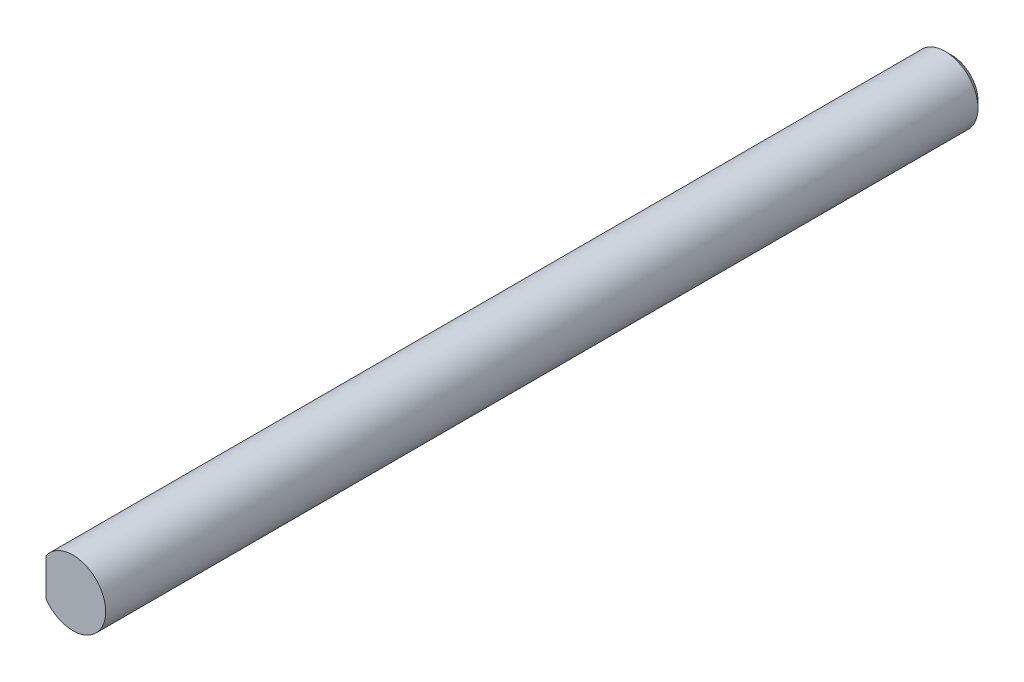
from build123d import *

# Parameters (mm, degrees)
CROQUIS1_R              = 2.5
SALIENTE_EXTRUIR1_DEPTH = 67
CUT_EXTRUDE1_START      = -15
CUT_EXTRUDE1_DEPTH      = 15
CHAMFER1_SIZE           = 0.5


with BuildPart() as part:
    # Croquis1 → Saliente-Extruir1 (new body)
    with BuildSketch(Plane.XY):
        Circle(CROQUIS1_R)
    extrude(amount=SALIENTE_EXTRUIR1_DEPTH)

    # Sketch1 → Cut-Extrude1 (cut)
    with BuildSketch(Plane.XY.offset(67).offset(CUT_EXTRUDE1_START)):
        with BuildLine():
            Line((-2.05, 1.430908802), (-2.05, -1.430908802))
            ThreePointArc((-2.05, -1.430908802), (-2.5, 0), (-2.05, 1.430908802))
        make_face()
    extrude(amount=CUT_EXTRUDE1_DEPTH, mode=Mode.SUBTRACT)

    # Chamfer1
    chamfer1_edges = [part.edges().sort_by_distance(p)[0] for p in [
        (-2.5, 0, 0),
    ]]
    chamfer(chamfer1_edges, length=CHAMFER1_SIZE)


solid = part.part
